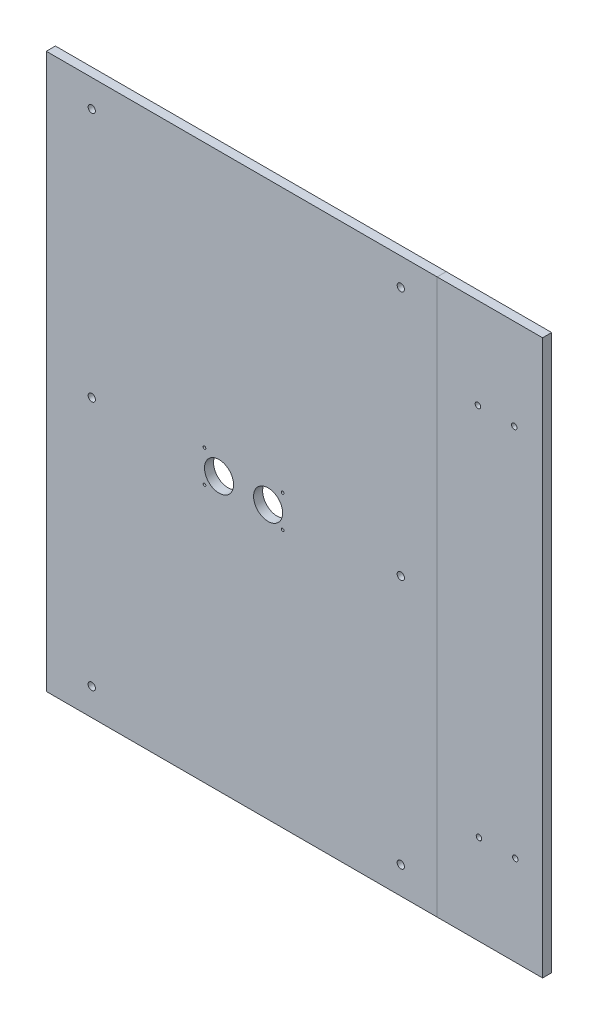
from build123d import *

# Parameters (mm, degrees)
ESQUISSE1_W             = 215
ESQUISSE1_H             = 305
BOSS_EXTRU_1_DEPTH      = 5
ESQUISSE2_R             = 2
ENL_V_MAT_EXTRU_1_DEPTH = 5
ESQUISSE3_W             = 58
ESQUISSE3_H             = 305
BOSS_EXTRU_2_DEPTH      = 5
ESQUISSE4_R             = 1.5
ENL_V_MAT_EXTRU_3_DEPTH = 410.364141077
ESQUISSE5_R             = 1.5
ENL_V_MAT_EXTRU_4_DEPTH = 410.364141077
ESQUISSE6_R             = 8
ENL_V_MAT_EXTRU_5_DEPTH = 410.364141077
ESQUISSE7_R             = 0.75
ENL_V_MAT_EXTRU_7_DEPTH = 410.364141077


with BuildPart() as part:
    # Esquisse1 → Boss.-Extru.1 (new body)
    with BuildSketch(Plane.XY):
        with Locations((107.5, 152.5)):
            Rectangle(ESQUISSE1_W, ESQUISSE1_H)
    extrude(amount=BOSS_EXTRU_1_DEPTH)

    # Esquisse2 → Enlèv. mat.-Extru.1 (cut)
    with BuildSketch(Plane(origin=(0, 0, 0), x_dir=(-1, 0, 0), z_dir=(0, 0, -1))):
        with Locations((-195, 290)):
            Circle(ESQUISSE2_R)
        with Locations((-25, 290)):
            Circle(ESQUISSE2_R)
        with Locations((-25, 15)):
            Circle(ESQUISSE2_R)
        with Locations((-195, 15)):
            Circle(ESQUISSE2_R)
        with Locations((-195, 152.5)):
            Circle(ESQUISSE2_R)
        with Locations((-25, 152.5)):
            Circle(ESQUISSE2_R)
    extrude(amount=-ENL_V_MAT_EXTRU_1_DEPTH, mode=Mode.SUBTRACT)

    # Esquisse6 → Enlèv. mat.-Extru.5 (cut, through all)
    with BuildSketch(Plane(origin=(0, 0, 0), x_dir=(-1, 0, 0), z_dir=(0, 0, -1))):
        with Locations((-122, 150)):
            Circle(ESQUISSE6_R)
        with Locations((-95, 150)):
            Circle(ESQUISSE6_R)
    extrude(amount=-ENL_V_MAT_EXTRU_5_DEPTH, mode=Mode.SUBTRACT)

    # Esquisse7 → Enlèv. mat.-Extru.7 (cut, through all)
    with BuildSketch(Plane(origin=(0, 0, 0), x_dir=(-1, 0, 0), z_dir=(0, 0, -1))):
        with Locations((-87, 159.7)):
            Circle(ESQUISSE7_R)
        with Locations((-130, 159.7)):
            Circle(ESQUISSE7_R)
        with Locations((-87, 142)):
            Circle(ESQUISSE7_R)
        with Locations((-130, 142)):
            Circle(ESQUISSE7_R)
    extrude(amount=-ENL_V_MAT_EXTRU_7_DEPTH, mode=Mode.SUBTRACT)


with BuildPart() as body_2:
    # Esquisse3 → Boss.-Extru.2 (new body)
    with BuildSketch(Plane(origin=(0, 0, 0), x_dir=(-1, 0, 0), z_dir=(0, 0, -1))):
        with Locations((-244, 152.5)):
            Rectangle(ESQUISSE3_W, ESQUISSE3_H)
    extrude(amount=-BOSS_EXTRU_2_DEPTH)

    # Esquisse4 → Enlèv. mat.-Extru.3 (cut, through all)
    with BuildSketch(Plane(origin=(0, 0, 0), x_dir=(-1, 0, 0), z_dir=(0, 0, -1))):
        with Locations((-237.4, 255)):
            Circle(ESQUISSE4_R)
        with Locations((-257.4, 255)):
            Circle(ESQUISSE4_R)
    extrude(amount=-ENL_V_MAT_EXTRU_3_DEPTH, mode=Mode.SUBTRACT)

    # Esquisse5 → Enlèv. mat.-Extru.4 (cut, through all)
    with BuildSketch(Plane.XY.offset(5)):
        with Locations((238, 49.5)):
            Circle(ESQUISSE5_R)
        with Locations((258, 49.5)):
            Circle(ESQUISSE5_R)
    extrude(amount=-ENL_V_MAT_EXTRU_4_DEPTH, mode=Mode.SUBTRACT)


solid = Compound([part.part, body_2.part])
